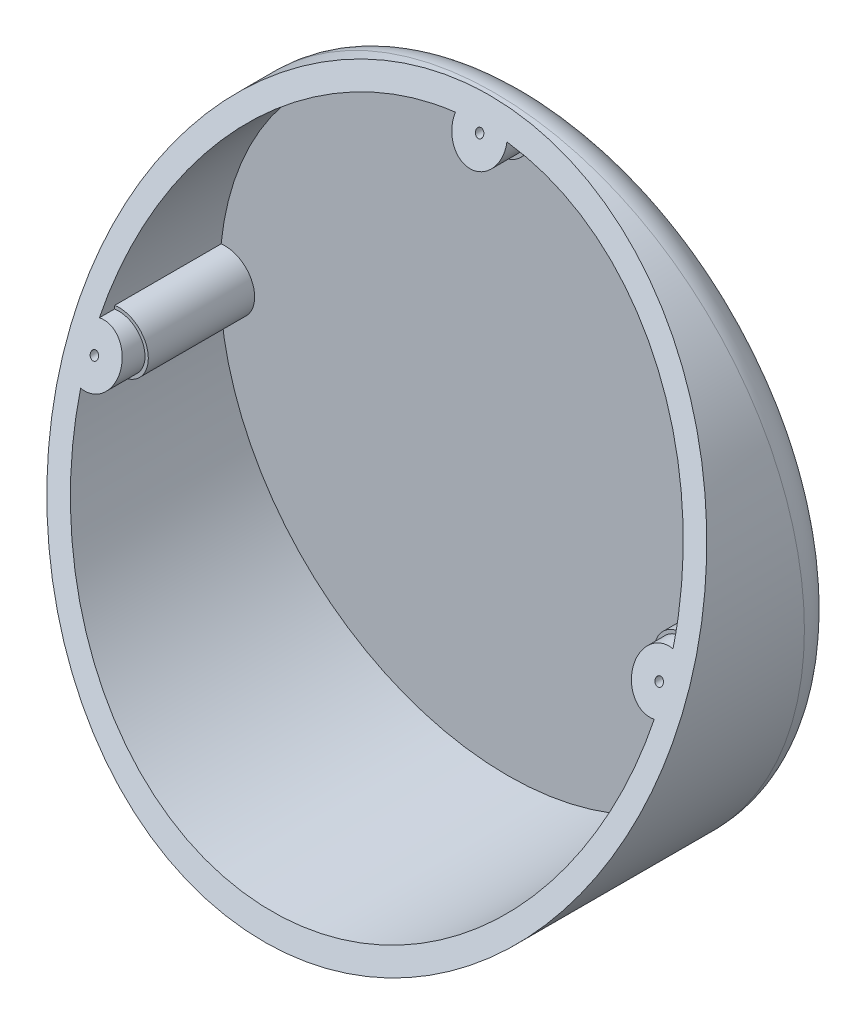
from build123d import *

# Parameters (mm, degrees)
SKETCH_1_R                = 70
EXTRUDE_1_DEPTH           = 60
CUT_EXTRUDE_1_DEPTH       = 116.758369028
CUT_EXTRUDE_1_DEPTH_BACK  = 116.758369028
HOLE_WIZARD_1_D           = 1.8
HOLE_WIZARD_1_CBORE_D     = 3.3
HOLE_WIZARD_1_CBORE_DEPTH = 1.8
HOLE_WIZARD_2_D           = 1.8
HOLE_WIZARD_2_CBORE_D     = 3.3
HOLE_WIZARD_2_CBORE_DEPTH = 24
SHELL_START               = 5
SHELL_1_DEPTH             = 53.180148829
SHELL_START_2             = 29
SHELL_1_2_DEPTH           = 29.180148829
SHELL_START_3             = 6.8
SHELL_1_3_DEPTH           = 22.2
FILLET_2_R                = 8


# Read off the part's stored shape, not the designer's step: 抽壳1
with BuildPart() as part:
    # 草图1 → 凸台-拉伸1 (new body)
    with BuildSketch(Plane.XY):
        Circle(SKETCH_1_R)
    extrude(amount=EXTRUDE_1_DEPTH)

    # 草图2 → 切除-拉伸1 (cut, two sides: drawn at the far end of the back side and taken through both)
    with BuildSketch(Plane(origin=(0, 0, 0), x_dir=(0, 0, -1), z_dir=(1, 0, 0)).offset(-CUT_EXTRUDE_1_DEPTH_BACK)):
        Polygon((-60, -70), (-60, 70), (-9.044167203, 70), align=None)
    extrude(amount=CUT_EXTRUDE_1_DEPTH + CUT_EXTRUDE_1_DEPTH_BACK, mode=Mode.SUBTRACT)

    # 打孔尺寸(%根据)内六角圆柱头螺钉的类型1 (through all)
    with Locations(Plane(origin=(0, 0, 0), x_dir=(-1, 0, 0), z_dir=(0, 0, -1))):
        with Locations((0, 63.75)):
            CounterBoreHole(HOLE_WIZARD_1_D / 2, HOLE_WIZARD_1_CBORE_D / 2, HOLE_WIZARD_1_CBORE_DEPTH)

    # 打孔尺寸(%根据)内六角圆柱头螺钉的类型2 (through all)
    with Locations(Plane(origin=(0, 0, 0), x_dir=(-1, 0, 0), z_dir=(0, 0, -1))):
        with Locations((-63.75, 0), (63.75, 0)):
            CounterBoreHole(HOLE_WIZARD_2_D / 2, HOLE_WIZARD_2_CBORE_D / 2, HOLE_WIZARD_2_CBORE_DEPTH)

    # 抽壳1 outline → 抽壳1 (cut)
    with BuildSketch(Plane.XY.offset(SHELL_START)):
        with BuildLine():
            ThreePointArc((-64.665411765, -6.586692744), (0, -65), (64.665411765, -6.586692744))
            ThreePointArc((64.665411765, -6.586692744), (57.1, 0), (64.665411765, 6.586692744))
            ThreePointArc((64.665411765, 6.586692744), (45.961940777, 45.961940777), (6.586692744, 64.665411765))
            ThreePointArc((6.586692744, 64.665411765), (0, 57.1), (-6.586692744, 64.665411765))
            ThreePointArc((-6.586692744, 64.665411765), (-45.961940777, 45.961940777), (-64.665411765, 6.586692744))
            ThreePointArc((-64.665411765, 6.586692744), (-57.1, 0), (-64.665411765, -6.586692744))
        make_face()
    extrude(amount=SHELL_1_DEPTH, mode=Mode.SUBTRACT)

    # Shell 1 2 outline → Shell 1 2 (cut)
    with BuildSketch(Plane.XY.offset(SHELL_START_2)):
        with BuildLine():
            ThreePointArc((64.665411765, -6.586692744), (64.703469597, -6.2016951), (64.739235294, -5.81647776))
            ThreePointArc((64.739235294, -5.81647776), (57.85, 0), (64.739235294, 5.81647776))
            ThreePointArc((64.739235294, 5.81647776), (64.703469597, 6.2016951), (64.665411765, 6.586692744))
            ThreePointArc((64.665411765, 6.586692744), (57.1, 0), (64.665411765, -6.586692744))
        make_face()
        with BuildLine():
            ThreePointArc((-64.739235294, -5.81647776), (-64.703469597, -6.2016951), (-64.665411765, -6.586692744))
            ThreePointArc((-64.665411765, -6.586692744), (-57.1, 0), (-64.665411765, 6.586692744))
            ThreePointArc((-64.665411765, 6.586692744), (-64.703469597, 6.2016951), (-64.739235294, 5.81647776))
            ThreePointArc((-64.739235294, 5.81647776), (-57.85, 0), (-64.739235294, -5.81647776))
        make_face()
    extrude(amount=SHELL_1_2_DEPTH, mode=Mode.SUBTRACT)

    # Shell 1 3 outline → Shell 1 3 (cut)
    with BuildSketch(Plane.XY.offset(SHELL_START_3)):
        with BuildLine():
            ThreePointArc((-6.586692744, 64.665411765), (0, 57.1), (6.586692744, 64.665411765))
            ThreePointArc((6.586692744, 64.665411765), (6.2016951, 64.703469597), (5.81647776, 64.739235294))
            ThreePointArc((5.81647776, 64.739235294), (0, 57.85), (-5.81647776, 64.739235294))
            ThreePointArc((-5.81647776, 64.739235294), (-6.2016951, 64.703469597), (-6.586692744, 64.665411765))
        make_face()
    extrude(amount=SHELL_1_3_DEPTH, mode=Mode.SUBTRACT)

    # 圆角2
    # the kernel refuses this fillet: 8 mm, written as the material it takes off along each edge
    with BuildSketch(Plane(origin=(0, 0, 0), x_dir=(1, 0, 0), z_dir=(0, -1, 0))) as fillet_2_piece_1:
        with BuildLine():
            CenterArc((70 - FILLET_2_R, FILLET_2_R), FILLET_2_R, 270, 90)
            Line((70 - FILLET_2_R, 0), (70, 0))
            Line((70, 0), (70, FILLET_2_R))
        make_face()
    revolve(axis=Axis((0, 0, 0), (0, 0, 1)), mode=Mode.SUBTRACT)


solid = part.part
